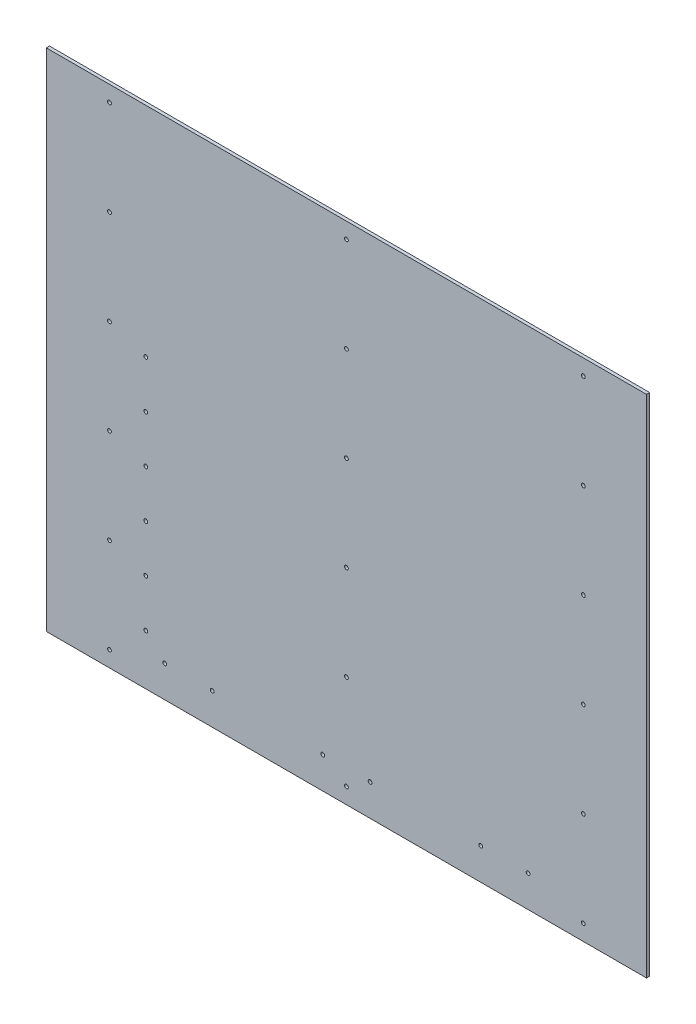
from build123d import *

# Parameters (mm, degrees)
SZKIC1_W                    = 1900
SZKIC1_H                    = 1600
DODANIE_WYCI_GNI_CIE1_DEPTH = 10
OTW_R_POD_RUB_M101_D        = 12
SZYK_LINIOWY1_COUNT         = 6
SZYK_LINIOWY1_PITCH         = 300
SZYK_LINIOWY1_COUNT_DIR2    = 3
SZYK_LINIOWY1_PITCH_DIR2    = 750
OTW_R_POD_RUB_M103_D        = 12
OTW_R_POD_RUB_M104_D        = 12
OTW_R_POD_RUB_M105_D        = 12


with BuildPart() as part:
    # Szkic1 → Dodanie-wyciągnięcie1 (new body)
    with BuildSketch(Plane.XY):
        Rectangle(SZKIC1_W, SZKIC1_H)
    extrude(amount=DODANIE_WYCI_GNI_CIE1_DEPTH)

    # Otwór pod śrubę M101 (through all)
    with Locations(Plane.XY.offset(10)):
        with Locations((-750, -750)):
            otw_r_pod_rub_m101 = Hole(OTW_R_POD_RUB_M101_D / 2)

    # Szyk liniowy1: Otw_r pod _rub_ M101 6 × 3
    with Locations(*[(j * SZYK_LINIOWY1_PITCH_DIR2, i * SZYK_LINIOWY1_PITCH, 0) for i in range(SZYK_LINIOWY1_COUNT) for j in range(SZYK_LINIOWY1_COUNT_DIR2) if (i, j) != (0, 0)]):
        add(otw_r_pod_rub_m101, mode=Mode.SUBTRACT)

    # Otwór pod śrubę M103 (through all)
    with Locations(Plane.XY.offset(10)):
        with Locations((-75, -700), (75, -700)):
            Hole(OTW_R_POD_RUB_M103_D / 2)

    # Otwór pod śrubę M104 (through all)
    with Locations(Plane.XY.offset(10)):
        with Locations((-575, -700), (-425, -700), (425, -700), (575, -700)):
            Hole(OTW_R_POD_RUB_M104_D / 2)

    # Otwór pod śrubę M105 (through all)
    with Locations(Plane.XY.offset(10)):
        with Locations((-635, 110), (-635, -40), (-635, -190), (-635, -340), (-635, -490), (-635, -640)):
            Hole(OTW_R_POD_RUB_M105_D / 2)


solid = part.part
